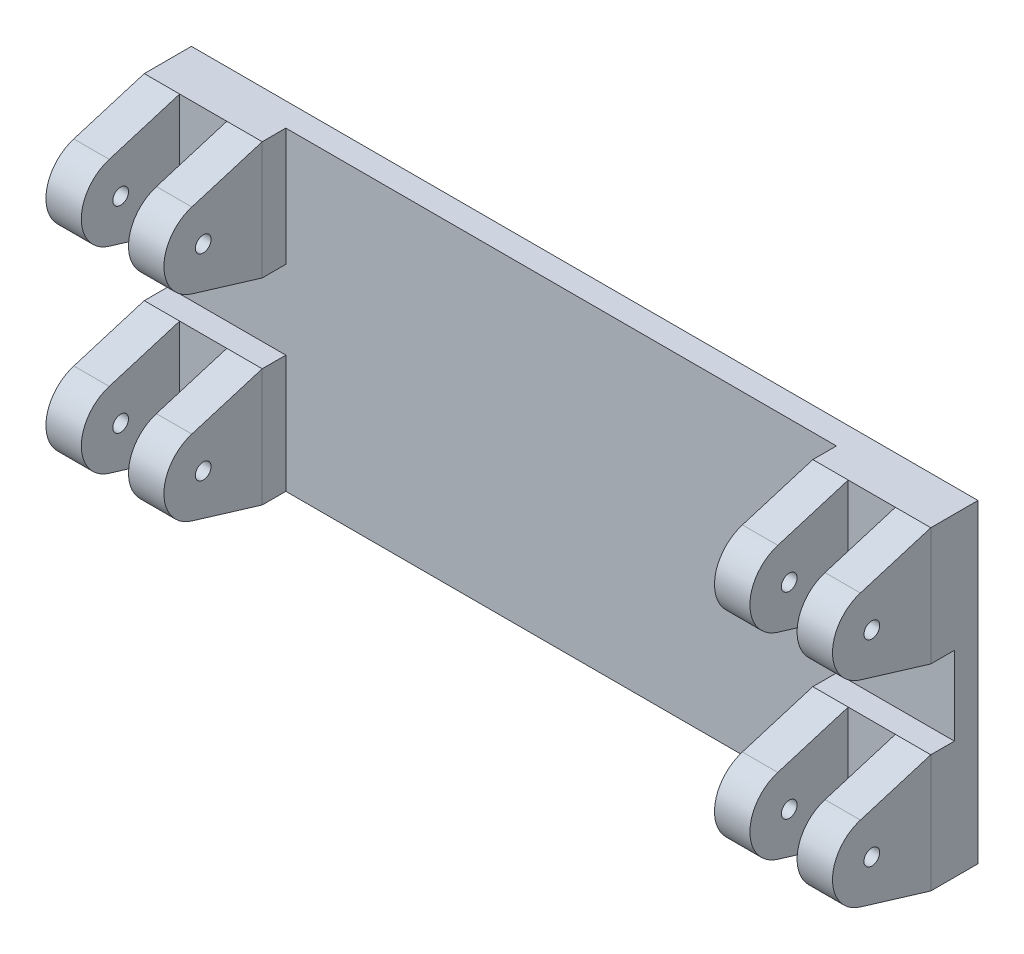
from build123d import *

# Parameters (mm, degrees)
SKETCH1_W           = 100
SKETCH1_H           = 40
BOSS_EXTRUDE1_DEPTH = 3
SKETCH2_W           = 15
SKETCH2_H           = 15
BOSS_EXTRUDE2_DEPTH = 3
SKETCH3_R           = 1
BOSS_EXTRUDE3_DEPTH = 15
CUT_EXTRUDE1_REACH  = 68.65
SKETCH4_W           = 6
SKETCH4_H           = 12.5
MIRROR6_START       = 35
MIRROR6_OUTLINE_R   = 1
MIRROR6_DEPTH       = 4.5
MIRROR6_START_2     = 45.5
MIRROR6_2_OUTLINE_R = 1
MIRROR6_2_DEPTH     = 4.5
MIRROR6_START_3     = -50
MIRROR6_3_OUTLINE_R = 1
MIRROR6_3_DEPTH     = 4.5
MIRROR6_START_4     = -39.5
MIRROR6_4_OUTLINE_R = 1
MIRROR6_4_DEPTH     = 4.5


# Read off the part's stored shape, not the designer's step: Mirror6
with BuildPart() as part:
    # Sketch1 → Boss-Extrude1 (new body)
    with BuildSketch(Plane.XY):
        Rectangle(SKETCH1_W, SKETCH1_H)
    extrude(amount=BOSS_EXTRUDE1_DEPTH)

    # Sketch2 → Boss-Extrude2 (add)
    with BuildSketch(Plane.XY.offset(3)):
        with Locations((-42.5, 12.5)):
            Rectangle(SKETCH2_W, SKETCH2_H)
        with Locations((-42.5, -12.5)):
            Rectangle(SKETCH2_W, SKETCH2_H)
        with Locations((42.5, -12.5)):
            Rectangle(SKETCH2_W, SKETCH2_H)
        with Locations((42.5, 12.5)):
            Rectangle(SKETCH2_W, SKETCH2_H)
    extrude(amount=BOSS_EXTRUDE2_DEPTH)


with BuildPart() as body_2:
    # Sketch3 → Boss-Extrude3 (new body)
    with BuildSketch(Plane.ZY.offset(50)):
        with BuildLine():
            Line((14.951381156, 7.715285511), (6, 5))
            Line((6, 5), (6, 20))
            Line((6, 20), (14.951381156, 17.284714489))
            ThreePointArc((14.951381156, 17.284714489), (18.5, 12.5), (14.951381156, 7.715285511))
        make_face()
        with Locations(Location((13.5, 12.5, 0), (0, 0, 270))):
            Circle(SKETCH3_R, mode=Mode.SUBTRACT)
    extrude(amount=-BOSS_EXTRUDE3_DEPTH)

    # Cut-Extrude1: up to this plane
    cut_extrude1_end = Plane(origin=(-15.47437581, 2.912031882, -0.883327147), z_dir=(0, 0.956942897795657, -0.29027623112899026))
    # Sketch4 → Cut-Extrude1 (cut, up to the surface)
    with BuildSketch(Plane(origin=(0, 20, 0), x_dir=(1, 0, 0), z_dir=(0, 1, 0)), mode=Mode.PRIVATE) as cut_extrude1_sk1:
        with Locations((-42.5, -12.25)):
            Rectangle(SKETCH4_W, SKETCH4_H)
    cut_extrude1_tool1 = split(extrude(cut_extrude1_sk1.sketch, amount=-CUT_EXTRUDE1_REACH, mode=Mode.PRIVATE), bisect_by=cut_extrude1_end, keep=Keep.BOTH, mode=Mode.PRIVATE)
    add(cut_extrude1_tool1.solids().sort_by_distance((-42.5, 20, 12.25))[0], mode=Mode.SUBTRACT)


with BuildPart() as cut_extrude1_piece_1:
    # of the separate pieces the step leaves, piece 1, a body of its own (cut_extrude1_pieces)
    add(body_2.part.solids().sort_by_distance((-39.5, 7.715285511, 14.951381156))[0])


with BuildPart() as cut_extrude1_piece_2:
    # of the separate pieces the step leaves, piece 2, a body of its own (cut_extrude1_pieces)
    add(body_2.part.solids().sort_by_distance((-50, 7.715285511, 14.951381156))[0])


with BuildPart() as body_4:
    # Mirror6 outline → Mirror6 (new body)
    # profile 1 of 2: a face of its own
    with BuildSketch(Plane.YZ.offset(MIRROR6_START)):
        with BuildLine():
            Line((-5, 6), (-7.715285511, 14.951381156))
            ThreePointArc((-7.715285511, 14.951381156), (-12.5, 18.5), (-17.284714489, 14.951381156))
            Line((-17.284714489, 14.951381156), (-20, 6))
            Line((-20, 6), (-5, 6))
        make_face()
        with Locations((-12.5, 13.5)):
            Circle(MIRROR6_OUTLINE_R, mode=Mode.SUBTRACT)
    # profile 2 of 2: a face of its own
    with BuildSketch(Plane.YZ.offset(MIRROR6_START)):
        with BuildLine():
            Line((5, 6), (20, 6))
            Line((20, 6), (17.284714489, 14.951381156))
            ThreePointArc((17.284714489, 14.951381156), (12.5, 18.5), (7.715285511, 14.951381156))
            Line((7.715285511, 14.951381156), (5, 6))
        make_face()
        with Locations((12.5, 13.5)):
            Circle(MIRROR6_OUTLINE_R, mode=Mode.SUBTRACT)
    extrude(amount=MIRROR6_DEPTH)


with BuildPart() as body_5:
    # Mirror6 2 outline → Mirror6 2 (new body)
    # profile 1 of 2: a face of its own
    with BuildSketch(Plane.YZ.offset(MIRROR6_START_2)):
        with BuildLine():
            Line((-5, 6), (-7.715285511, 14.951381156))
            ThreePointArc((-7.715285511, 14.951381156), (-12.5, 18.5), (-17.284714489, 14.951381156))
            Line((-17.284714489, 14.951381156), (-20, 6))
            Line((-20, 6), (-5, 6))
        make_face()
        with Locations((-12.5, 13.5)):
            Circle(MIRROR6_2_OUTLINE_R, mode=Mode.SUBTRACT)
    # profile 2 of 2: a face of its own
    with BuildSketch(Plane.YZ.offset(MIRROR6_START_2)):
        with BuildLine():
            Line((5, 6), (20, 6))
            Line((20, 6), (17.284714489, 14.951381156))
            ThreePointArc((17.284714489, 14.951381156), (12.5, 18.5), (7.715285511, 14.951381156))
            Line((7.715285511, 14.951381156), (5, 6))
        make_face()
        with Locations((12.5, 13.5)):
            Circle(MIRROR6_2_OUTLINE_R, mode=Mode.SUBTRACT)
    extrude(amount=MIRROR6_2_DEPTH)


with BuildPart() as body_6:
    # Mirror6 3 outline → Mirror6 3 (new body)
    with BuildSketch(Plane.YZ.offset(MIRROR6_START_3)):
        with BuildLine():
            Line((-5, 6), (-7.715285511, 14.951381156))
            ThreePointArc((-7.715285511, 14.951381156), (-12.5, 18.5), (-17.284714489, 14.951381156))
            Line((-17.284714489, 14.951381156), (-20, 6))
            Line((-20, 6), (-5, 6))
        make_face()
        with Locations((-12.5, 13.5)):
            Circle(MIRROR6_3_OUTLINE_R, mode=Mode.SUBTRACT)
    extrude(amount=MIRROR6_3_DEPTH)


with BuildPart() as body_7:
    # Mirror6 4 outline → Mirror6 4 (new body)
    with BuildSketch(Plane.YZ.offset(MIRROR6_START_4)):
        with BuildLine():
            Line((-5, 6), (-7.715285511, 14.951381156))
            ThreePointArc((-7.715285511, 14.951381156), (-12.5, 18.5), (-17.284714489, 14.951381156))
            Line((-17.284714489, 14.951381156), (-20, 6))
            Line((-20, 6), (-5, 6))
        make_face()
        with Locations((-12.5, 13.5)):
            Circle(MIRROR6_4_OUTLINE_R, mode=Mode.SUBTRACT)
    extrude(amount=MIRROR6_4_DEPTH)


solid = Compound([part.part, cut_extrude1_piece_1.part, cut_extrude1_piece_2.part, body_4.part, body_5.part, body_6.part, body_7.part])
